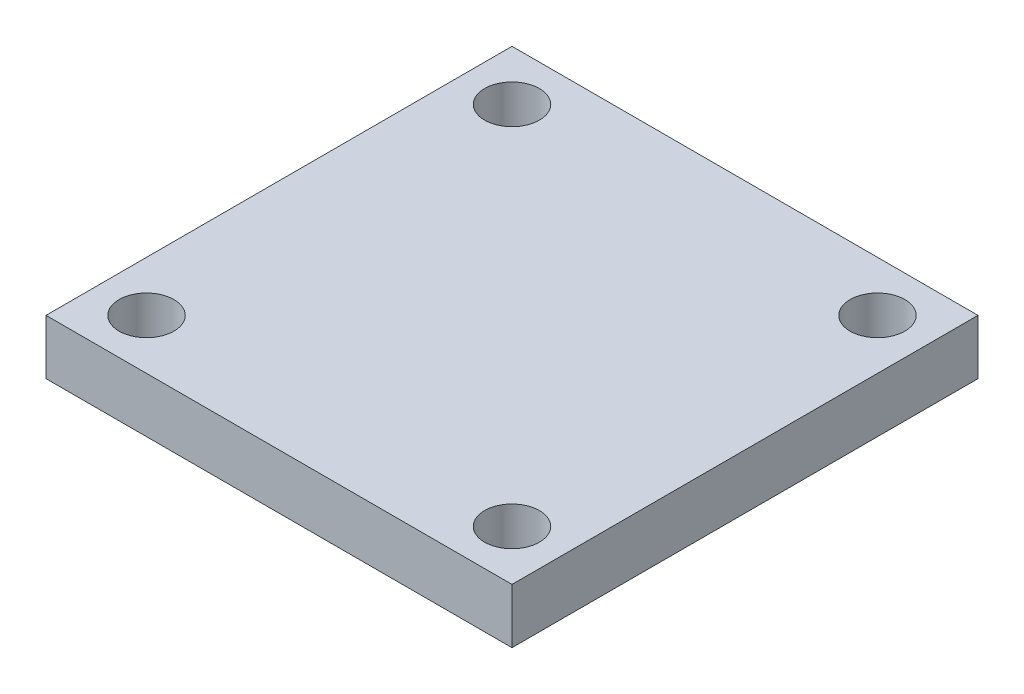
from build123d import *

# Parameters (mm, degrees)
SKETCH2_W             = 25.5
SKETCH2_H             = 25.5
SKETCH2_R             = 1.5
FLIGHT_COMPUTER_DEPTH = 3


with BuildPart() as part:
    # Sketch2 → Flight Computer (new body)
    with BuildSketch(Plane(origin=(0, 0, 0), x_dir=(1, 0, 0), z_dir=(0, 1, 0))):
        Rectangle(SKETCH2_W, SKETCH2_H)
        with Locations((-10, -10)):
            Circle(SKETCH2_R, mode=Mode.SUBTRACT)
        with Locations((10, -10)):
            Circle(SKETCH2_R, mode=Mode.SUBTRACT)
        with Locations((-10, 10)):
            Circle(SKETCH2_R, mode=Mode.SUBTRACT)
        with Locations((10, 10)):
            Circle(SKETCH2_R, mode=Mode.SUBTRACT)
    extrude(amount=FLIGHT_COMPUTER_DEPTH)


solid = part.part
